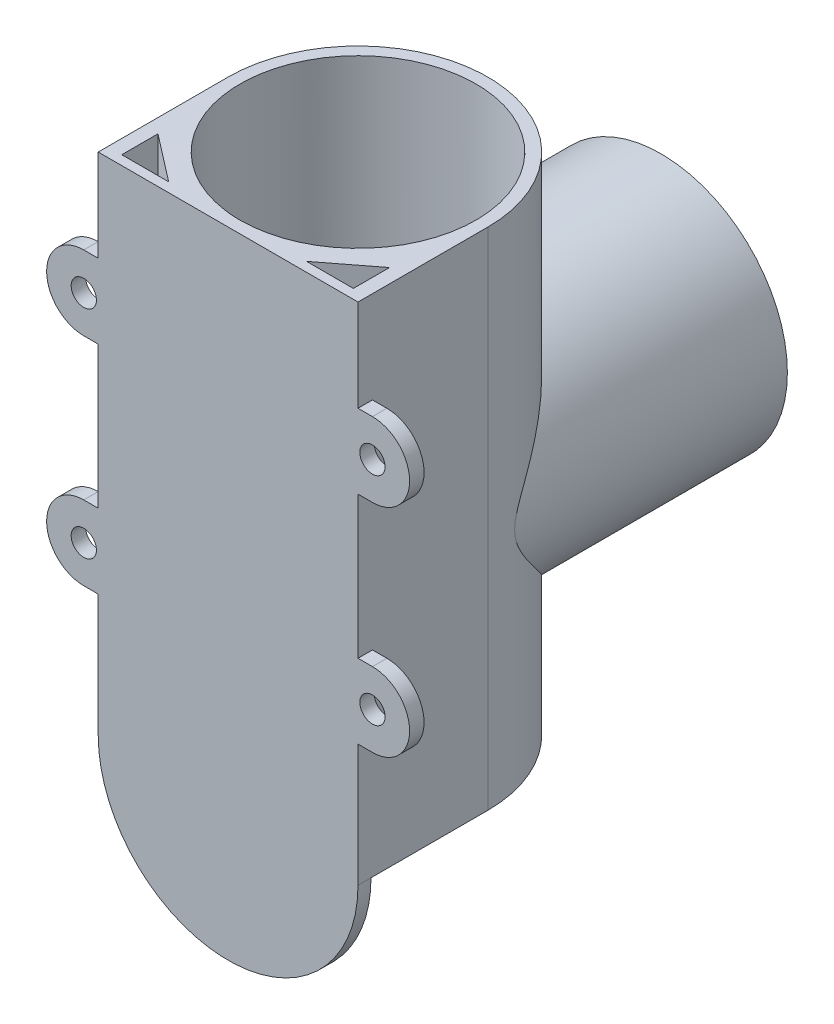
from build123d import *

# Parameters (mm, degrees)
SKETCH1_R               = 16.35
BOSS_EXTRUDE1_DEPTH     = 70
BOSS_EXTRUDE3_DEPTH     = 1.8
SKETCH6_R               = 1.75
BOSS_EXTRUDE4_DEPTH     = 2
CUT_EXTRUDE4_START      = -10
SKETCH2_R               = 15.24
CUT_EXTRUDE4_DEPTH      = 90
EXTRUDE_THIN1_START     = -2
SKETCH8_R               = 17.5
SKETCH8_R_2             = 15.5
EXTRUDE_THIN1_DEPTH     = 40
CUT_EXTRUDE5_DEPTH      = 86.419835842
CUT_EXTRUDE5_DEPTH_BACK = 86.419835842
SKETCH9_R               = 16.35


with BuildPart() as part:
    # Sketch1 → Boss-Extrude1 (new body)
    with BuildSketch(Plane(origin=(0, 0, 0), x_dir=(1, 0, 0), z_dir=(0, 1, 0))):
        with BuildLine():
            Line((18, -18), (-18, -18))
            Line((-18, -18), (-18, 0))
            ThreePointArc((-18, 0), (0, 18), (18, 0))
            Line((18, 0), (18, -18))
        make_face()
        Circle(SKETCH1_R, mode=Mode.SUBTRACT)
        Polygon((-16.046179107, -16.69097289), (-9.54916716, -16.69097289), (-16.046179107, -11.676500582), align=None, mode=Mode.SUBTRACT)
        Polygon((16.046179107, -16.69097289), (9.54916716, -16.69097289), (16.046179107, -11.676500582), align=None, mode=Mode.SUBTRACT)
    extrude(amount=BOSS_EXTRUDE1_DEPTH)

    # Sketch4 → Boss-Extrude3 (add)
    with BuildSketch(Plane.XY.offset(18)):
        with BuildLine():
            Line((-18, 0), (18, 0))
            ThreePointArc((18, 0), (0, -18), (-18, 0))
        make_face()
    extrude(amount=-BOSS_EXTRUDE3_DEPTH)

    # Sketch6 → Boss-Extrude4 (add)
    # profile 1 of 4: a face of its own
    with BuildSketch(Plane.XY.offset(18)):
        with BuildLine():
            Line((-12.295931899, 27.247291992), (-12.295931899, 16.947291992))
            Line((-12.295931899, 16.947291992), (-20, 16.947291992))
            ThreePointArc((-20, 16.947291992), (-25.15, 22.097291992), (-20, 27.247291992))
            Line((-20, 27.247291992), (-12.295931899, 27.247291992))
        make_face()
        with Locations((-20, 22.097291992)):
            Circle(SKETCH6_R, mode=Mode.SUBTRACT)
    # profile 2 of 4: a face of its own
    with BuildSketch(Plane.XY.offset(18)):
        with BuildLine():
            Line((-20, 46.94677842), (-12.295931899, 46.94677842))
            Line((-12.295931899, 46.94677842), (-12.295931899, 57.247805565))
            Line((-12.295931899, 57.247805565), (-20, 57.247805565))
            ThreePointArc((-20, 57.247805565), (-25.150513572, 52.097291992), (-20, 46.94677842))
        make_face()
        with Locations((-20, 52.097291992)):
            Circle(SKETCH6_R, mode=Mode.SUBTRACT)
    # profile 3 of 4: a face of its own
    with BuildSketch(Plane.XY.offset(18)):
        with BuildLine():
            Line((9.171216253, 57.247805565), (20, 57.247805565))
            ThreePointArc((20, 57.247805565), (25.150513572, 52.097291992), (20, 46.94677842))
            Line((20, 46.94677842), (9.171216253, 46.94677842))
            Line((9.171216253, 46.94677842), (9.171216253, 57.247805565))
        make_face()
        with Locations((20, 52.097291992)):
            Circle(SKETCH6_R, mode=Mode.SUBTRACT)
    # profile 4 of 4: a face of its own
    with BuildSketch(Plane.XY.offset(18)):
        with BuildLine():
            Line((9.171216253, 27.247291992), (9.171216253, 16.947291992))
            Line((9.171216253, 16.947291992), (20, 16.947291992))
            ThreePointArc((20, 16.947291992), (25.15, 22.097291992), (20, 27.247291992))
            Line((20, 27.247291992), (9.171216253, 27.247291992))
        make_face()
        with Locations((20, 22.097291992)):
            Circle(SKETCH6_R, mode=Mode.SUBTRACT)
    extrude(amount=-BOSS_EXTRUDE4_DEPTH)

    # Sketch2 → Cut-Extrude4 (cut)
    with BuildSketch(Plane.XY.offset(18).offset(CUT_EXTRUDE4_START)):
        with Locations((0, 31.291569462)):
            Circle(SKETCH2_R)
    extrude(amount=-CUT_EXTRUDE4_DEPTH, mode=Mode.SUBTRACT)

    # Sketch8 → Extrude-Thin1 (add)
    with BuildSketch(Plane.XY.offset(EXTRUDE_THIN1_START)):
        with Locations((0, 31.291569462)):
            Circle(SKETCH8_R)
        with Locations((0, 31.291569462)):
            Circle(SKETCH8_R_2, mode=Mode.SUBTRACT)
    extrude(amount=-EXTRUDE_THIN1_DEPTH)

    # Sketch9 → Cut-Extrude5 (cut, two sides: drawn at the far end of the back side and taken through both)
    with BuildSketch(Plane(origin=(0, 0, 0), x_dir=(1, 0, 0), z_dir=(0, 1, 0)).offset(-CUT_EXTRUDE5_DEPTH_BACK)):
        Circle(SKETCH9_R)
    extrude(amount=CUT_EXTRUDE5_DEPTH + CUT_EXTRUDE5_DEPTH_BACK, mode=Mode.SUBTRACT)


solid = part.part
